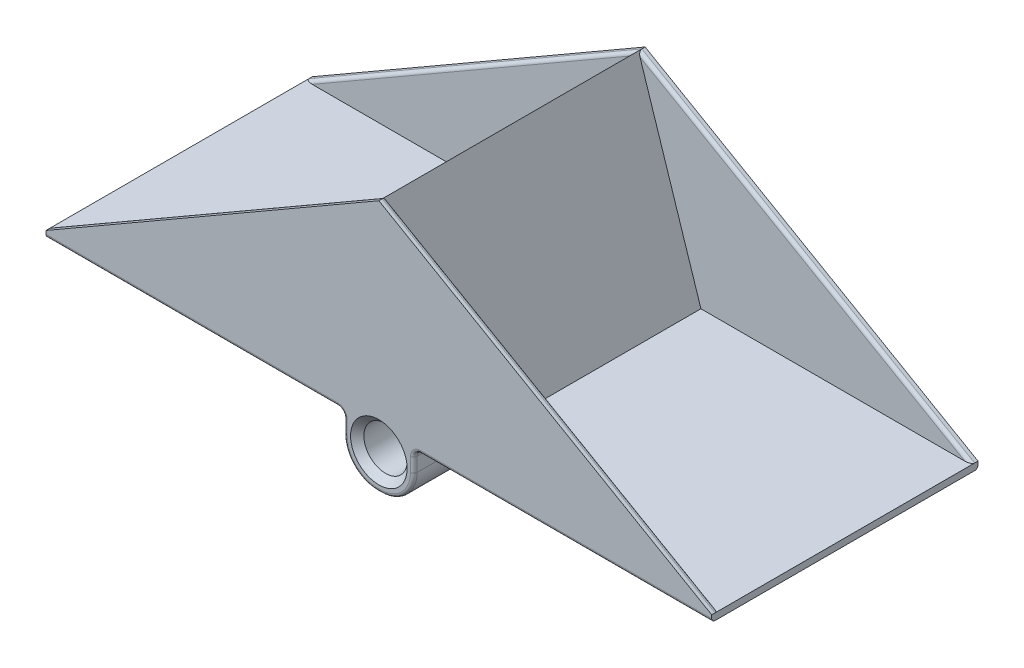
from build123d import *

# Parameters (mm, degrees)
SALIENTE_EXTRUIR1_DEPTH = 1
CROQUIS3_W              = 100
CROQUIS3_H              = 40
SALIENTE_EXTRUIR2_DEPTH = 1
CROQUIS5_W              = 10.5
CROQUIS5_H              = 8.1
SALIENTE_EXTRUIR3_DEPTH = 20
SALIENTE_EXTRUIR4_DEPTH = 20
CROQUIS7_R              = 3.25
CORTAR_EXTRUIR1_DEPTH   = 100
REDONDEO2_R             = 5
CHAFL_N2_SIZE           = 1
REDONDEO3_R             = 1
REDONDEO4_R             = 0.5
REDONDEO5_R             = 0.5


with BuildPart() as part:
    # Croquis1 → Saliente-Extruir1 (new body)
    with BuildSketch(Plane.XY.offset(20)):
        Polygon((-50, 0), (50, 0), (0, 28.867513459), align=None)
    extrude(amount=-SALIENTE_EXTRUIR1_DEPTH)


with BuildPart() as body_2:
    # Simetría4: mirrored copy
    add(part.part.mirror(Plane.XY))


with BuildPart() as part_1:
    add(part.part)

    add(body_2.part)  # Saliente-Extruir2 merges body 2
    # Croquis3 → Saliente-Extruir2 (add)
    with BuildSketch(Plane(origin=(0, 0, 0), x_dir=(1, 0, 0), z_dir=(0, 1, 0))):
        Rectangle(CROQUIS3_W, CROQUIS3_H)
    extrude(amount=-SALIENTE_EXTRUIR2_DEPTH)

    # Croquis5 → Saliente-Extruir3 (add, symmetric)
    with BuildSketch(Plane.XY):
        with Locations((0, -5.05)):
            Rectangle(CROQUIS5_W, CROQUIS5_H)
    extrude(amount=SALIENTE_EXTRUIR3_DEPTH, both=True)

    # Croquis6 → Saliente-Extruir4 (add, symmetric)
    with BuildSketch(Plane.XY):
        Polygon((0, 28.867513459), (9.379623704, 0), (-9.379623704, 0), align=None)
    extrude(amount=SALIENTE_EXTRUIR4_DEPTH, both=True)

    # Croquis7 → Cortar-Extruir1 (cut, symmetric)
    with BuildSketch(Plane.XY.offset(-19)):
        with Locations(Location((0, -3.85, 0), (0, 0, 180))):
            Circle(CROQUIS7_R)
    extrude(amount=CORTAR_EXTRUIR1_DEPTH, both=True, mode=Mode.SUBTRACT)

    # Redondeo2
    redondeo2_edges = [part_1.edges().sort_by_distance(p)[0] for p in [
        (-5.25, -9.1, 0),
        (5.25, -9.1, 0),
    ]]
    fillet(redondeo2_edges, radius=REDONDEO2_R)

    # Chaflán2
    chafl_n2_edges = [part_1.edges().sort_by_distance(p)[0] for p in [
        (3.25, -3.85, -20),
        (3.25, -3.85, 20),
    ]]
    chamfer(chafl_n2_edges, length=CHAFL_N2_SIZE)

    # Redondeo3
    redondeo3_edges = [part_1.edges().sort_by_distance(p)[0] for p in [
        (5.25, -1, 0),
        (-5.25, -1, 0),
    ]]
    fillet(redondeo3_edges, radius=REDONDEO3_R)

    # Redondeo4
    redondeo4_edges = [part_1.edges().sort_by_distance(p)[0] for p in [
        (-5.542893219, -1.292893219, 20),
        (-28.125, -1, 20),
        (28.125, -1, -20),
        (5.25, -3.05, -20),
        (5.25, -3.05, 20),
        (0, -9.1, -20),
        (-3.785533906, -7.635533906, -20),
        (3.785533906, -7.635533906, -20),
        (0, -9.1, 20),
        (-3.785533906, -7.635533906, 20),
        (3.785533906, -7.635533906, 20),
        (28.125, -1, 20),
        (-5.25, -3.05, -20),
        (-5.25, -3.05, 20),
        (-28.125, -1, -20),
        (5.542893219, -1.292893219, -20),
        (5.542893219, -1.292893219, 20),
        (-5.542893219, -1.292893219, -20),
    ]]
    fillet(redondeo4_edges, radius=REDONDEO4_R)

    # Redondeo5
    # the kernel refuses this fillet: 0.5 mm, written as the material it takes off along each edge
    with BuildSketch(Plane(origin=(1.082531755, 29.492513459, 19), x_dir=(0, 0, 1), z_dir=(-0.8660254037844387, -0.5000000000000001, 0))) as redondeo5_piece_1_section:
        with BuildLine():
            CenterArc((REDONDEO5_R, -REDONDEO5_R), REDONDEO5_R, 90, 90)
            Line((0, -REDONDEO5_R), (0, 0))
            Line((0, 0), (REDONDEO5_R, 0))
        make_face()
    redondeo5_piece_1 = extrude(amount=60.235026919, mode=Mode.PRIVATE)
    redondeo5_piece_1 = split(redondeo5_piece_1, bisect_by=Plane(origin=(0.055315574, 28.697269627, 19.065385241), z_dir=(0.9510565162951544, 0.30901699437494506, 0)), keep=Keep.TOP, mode=Mode.PRIVATE)
    add(redondeo5_piece_1, mode=Mode.SUBTRACT)
    with BuildSketch(Plane(origin=(1.082531755, 29.492513459, 19), x_dir=(0, 0, 1), z_dir=(-0.8660254037844387, -0.5000000000000001, 0))) as redondeo5_piece_2_section:
        with BuildLine():
            CenterArc((REDONDEO5_R, -REDONDEO5_R), REDONDEO5_R, 90, 90)
            Line((0, -REDONDEO5_R), (0, 0))
            Line((0, 0), (REDONDEO5_R, 0))
        make_face()
    redondeo5_piece_2 = extrude(amount=60.235026919, mode=Mode.PRIVATE)
    redondeo5_piece_2 = split(redondeo5_piece_2, bisect_by=Plane(origin=(-24.914439582, 0, 19.11193997), z_dir=(0, 1, 0)), keep=Keep.TOP, mode=Mode.PRIVATE)
    redondeo5_piece_2 = split(redondeo5_piece_2, bisect_by=Plane(origin=(-6.644327312, 8.418376676, 19.11193997), z_dir=(-0.9510565162951545, 0.30901699437494473, 0)), keep=Keep.TOP, mode=Mode.PRIVATE)
    add(redondeo5_piece_2, mode=Mode.SUBTRACT)
    with BuildSketch(Plane(origin=(51.082531755, -0.625, -19), x_dir=(0, 0, -1), z_dir=(-0.8660254037844388, 0.49999999999999983, 0))) as redondeo5_piece_3_section:
        with BuildLine():
            CenterArc((REDONDEO5_R, REDONDEO5_R), REDONDEO5_R, 180, 90)
            Line((0, REDONDEO5_R), (0, 0))
            Line((0, 0), (REDONDEO5_R, 0))
        make_face()
    redondeo5_piece_3 = extrude(amount=60.235026919, mode=Mode.PRIVATE)
    redondeo5_piece_3 = split(redondeo5_piece_3, bisect_by=Plane(origin=(24.914439582, 0, -19.11193997), z_dir=(0, 1, 0)), keep=Keep.TOP, mode=Mode.PRIVATE)
    redondeo5_piece_3 = split(redondeo5_piece_3, bisect_by=Plane(origin=(6.644327312, 8.418376676, -19.11193997), z_dir=(0.9510565162951544, 0.30901699437494506, 0)), keep=Keep.TOP, mode=Mode.PRIVATE)
    add(redondeo5_piece_3, mode=Mode.SUBTRACT)
    with BuildSketch(Plane(origin=(51.082531755, -0.625, -19), x_dir=(0, 0, -1), z_dir=(-0.8660254037844388, 0.49999999999999983, 0))) as redondeo5_piece_4_section:
        with BuildLine():
            CenterArc((REDONDEO5_R, REDONDEO5_R), REDONDEO5_R, 180, 90)
            Line((0, REDONDEO5_R), (0, 0))
            Line((0, 0), (REDONDEO5_R, 0))
        make_face()
    redondeo5_piece_4 = extrude(amount=60.235026919, mode=Mode.PRIVATE)
    redondeo5_piece_4 = split(redondeo5_piece_4, bisect_by=Plane(origin=(-0.055315574, 28.697269627, -19.065385241), z_dir=(-0.9510565162951545, 0.30901699437494473, 0)), keep=Keep.TOP, mode=Mode.PRIVATE)
    add(redondeo5_piece_4, mode=Mode.SUBTRACT)
    with BuildSketch(Plane(origin=(1.082531755, 29.492513459, -19), x_dir=(0, 0, -1), z_dir=(-0.8660254037844387, -0.5000000000000001, 0))) as redondeo5_piece_5_section:
        with BuildLine():
            CenterArc((REDONDEO5_R, REDONDEO5_R), REDONDEO5_R, 180, 90)
            Line((0, REDONDEO5_R), (0, 0))
            Line((0, 0), (REDONDEO5_R, 0))
        make_face()
    redondeo5_piece_5 = extrude(amount=60.235026919, mode=Mode.PRIVATE)
    redondeo5_piece_5 = split(redondeo5_piece_5, bisect_by=Plane(origin=(0.055315574, 28.697269627, -19.065385241), z_dir=(0.9510565162951544, 0.30901699437494506, 0)), keep=Keep.TOP, mode=Mode.PRIVATE)
    add(redondeo5_piece_5, mode=Mode.SUBTRACT)
    with BuildSketch(Plane(origin=(1.082531755, 29.492513459, -19), x_dir=(0, 0, -1), z_dir=(-0.8660254037844387, -0.5000000000000001, 0))) as redondeo5_piece_6_section:
        with BuildLine():
            CenterArc((REDONDEO5_R, REDONDEO5_R), REDONDEO5_R, 180, 90)
            Line((0, REDONDEO5_R), (0, 0))
            Line((0, 0), (REDONDEO5_R, 0))
        make_face()
    redondeo5_piece_6 = extrude(amount=60.235026919, mode=Mode.PRIVATE)
    redondeo5_piece_6 = split(redondeo5_piece_6, bisect_by=Plane(origin=(-24.914439582, 0, -19.11193997), z_dir=(0, 1, 0)), keep=Keep.TOP, mode=Mode.PRIVATE)
    redondeo5_piece_6 = split(redondeo5_piece_6, bisect_by=Plane(origin=(-6.644327312, 8.418376676, -19.11193997), z_dir=(-0.9510565162951545, 0.30901699437494473, 0)), keep=Keep.TOP, mode=Mode.PRIVATE)
    add(redondeo5_piece_6, mode=Mode.SUBTRACT)
    with BuildSketch(Plane(origin=(51.082531755, -0.625, 19), x_dir=(0, 0, 1), z_dir=(-0.8660254037844388, 0.49999999999999983, 0))) as redondeo5_piece_7_section:
        with BuildLine():
            CenterArc((REDONDEO5_R, -REDONDEO5_R), REDONDEO5_R, 90, 90)
            Line((0, -REDONDEO5_R), (0, 0))
            Line((0, 0), (REDONDEO5_R, 0))
        make_face()
    redondeo5_piece_7 = extrude(amount=60.235026919, mode=Mode.PRIVATE)
    redondeo5_piece_7 = split(redondeo5_piece_7, bisect_by=Plane(origin=(24.914439582, 0, 19.11193997), z_dir=(0, 1, 0)), keep=Keep.TOP, mode=Mode.PRIVATE)
    redondeo5_piece_7 = split(redondeo5_piece_7, bisect_by=Plane(origin=(6.644327312, 8.418376676, 19.11193997), z_dir=(0.9510565162951544, 0.30901699437494506, 0)), keep=Keep.TOP, mode=Mode.PRIVATE)
    add(redondeo5_piece_7, mode=Mode.SUBTRACT)
    with BuildSketch(Plane(origin=(51.082531755, -0.625, 19), x_dir=(0, 0, 1), z_dir=(-0.8660254037844388, 0.49999999999999983, 0))) as redondeo5_piece_8_section:
        with BuildLine():
            CenterArc((REDONDEO5_R, -REDONDEO5_R), REDONDEO5_R, 90, 90)
            Line((0, -REDONDEO5_R), (0, 0))
            Line((0, 0), (REDONDEO5_R, 0))
        make_face()
    redondeo5_piece_8 = extrude(amount=60.235026919, mode=Mode.PRIVATE)
    redondeo5_piece_8 = split(redondeo5_piece_8, bisect_by=Plane(origin=(-0.055315574, 28.697269627, 19.065385241), z_dir=(-0.9510565162951545, 0.30901699437494473, 0)), keep=Keep.TOP, mode=Mode.PRIVATE)
    add(redondeo5_piece_8, mode=Mode.SUBTRACT)


solid = part_1.part
